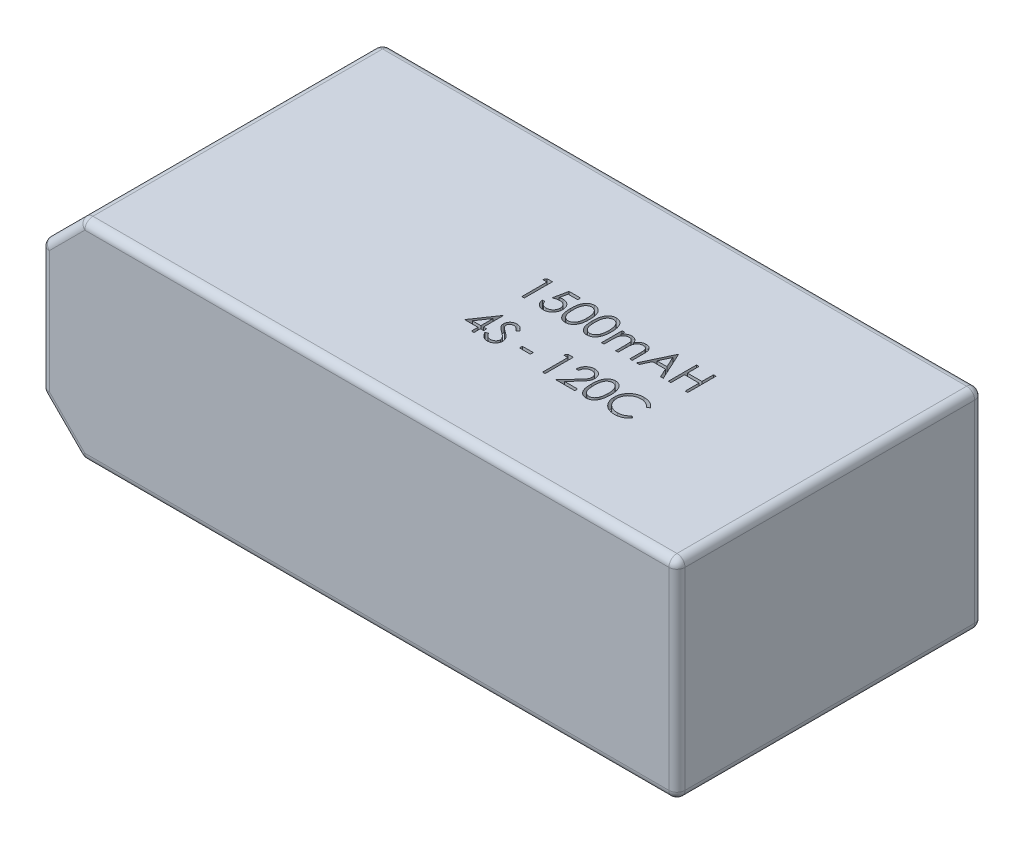
from build123d import *

# Parameters (mm, degrees)
SKETCH1_W           = 79
SKETCH1_H           = 38
BOSS_EXTRUDE1_DEPTH = 13
CHAMFER1_SIZE       = 5
FILLET1_R           = 1
SKETCH2_W           = 1.346153846
SKETCH2_H           = 0.358974359
CUT_EXTRUDE1_DEPTH  = 1


with BuildPart() as part:
    # Sketch1 → Boss-Extrude1 (new, symmetric)
    with BuildSketch(Plane(origin=(0, 0, 0), x_dir=(1, 0, 0), z_dir=(0, 1, 0))):
        Rectangle(SKETCH1_W, SKETCH1_H)
    extrude(amount=BOSS_EXTRUDE1_DEPTH, both=True)

    # Chamfer1
    chamfer1_edges = [part.edges().sort_by_distance(p)[0] for p in [
        (-39.5, 13, 0),
        (-39.5, -13, 0),
    ]]
    chamfer(chamfer1_edges, length=CHAMFER1_SIZE)

    # Fillet1
    fillet1_edges = [part.edges().sort_by_distance(p)[0] for p in [
        (39.5, -13, 0),
        (39.5, 13, 0),
        (-37, -10.5, -19),
        (-39.5, 0, -19),
        (-37, 10.5, -19),
        (2.5, -13, -19),
        (39.5, 0, -19),
        (2.5, 13, -19),
        (-37, -10.5, 19),
        (-39.5, 0, 19),
        (-37, 10.5, 19),
        (39.5, 0, 19),
        (2.5, 13, 19),
        (2.5, -13, 19),
        (-34.5, -13, 0),
        (-39.5, -8, 0),
        (-34.5, 13, 0),
        (-39.5, 8, 0),
    ]]
    fillet(fillet1_edges, radius=FILLET1_R)

    # Sketch2 → Cut-Extrude1 (cut)
    # profile 1 of 14: a face of its own
    with BuildSketch(Plane(origin=(0, 13, 0), x_dir=(1, 0, 0), z_dir=(0, 1, 0))):
        Polygon((0.878505609, 3.5), (1.525641026, 3.5), (1.525641026, 0), (1.211538462, 0), (1.211538462, 3.141025641), (0.673076923, 3.141025641), align=None)
    # profile 2 of 14: a face of its own
    with BuildSketch(Plane(origin=(0, 13, 0), x_dir=(1, 0, 0), z_dir=(0, 1, 0))):
        with BuildLine():
            Line((5.025641026, 3.5), (5.025641026, 3.141025641))
            Line((5.025641026, 3.141025641), (3.835136218, 3.141025641))
            Line((3.835136218, 3.141025641), (3.646534455, 2.220452724))
            add(Edge.make_bspline(
                [(3.646534455, 2.220452724), (3.68359033, 2.230682996), (3.755380225, 2.25050253), (3.861340086, 2.2725083), (3.96193229, 2.285773744), (4.02720766, 2.287585055), (4.058794071, 2.288461538)],
                knots=[0, 0, 0, 0, 1.100273476, 2.13160584, 3.095893838, 4, 4, 4, 4], degree=3))
            add(Edge.make_bspline(
                [(4.058794071, 2.288461538), (4.09787781, 2.287615603), (4.174726208, 2.285952282), (4.287165155, 2.269980432), (4.394498048, 2.244840518), (4.496500418, 2.209719996), (4.593360969, 2.164810263), (4.68418853, 2.108710322), (4.770346443, 2.043176991), (4.850289037, 1.967831979), (4.922813345, 1.884910363), (4.986579335, 1.795752492), (5.040741925, 1.701224829), (5.08430268, 1.600424221), (5.119087014, 1.494465067), (5.142239009, 1.382232485), (5.157655718, 1.264784365), (5.159378104, 1.184479795), (5.16025641, 1.143529647)],
                knots=[0, 0, 0, 0, 1.052922333, 2.070308379, 3.05430497, 4.020497103, 4.973039431, 5.925935799, 6.892292201, 7.88610001, 8.88166317, 9.857072816, 10.836096531, 11.812156883, 12.81219415, 13.836441305, 14.89672472, 16, 16, 16, 16], degree=3))
            add(Edge.make_bspline(
                [(5.16025641, 1.143529647), (5.159591335, 1.115007427), (5.158270172, 1.05834844), (5.151551585, 0.974204239), (5.138615869, 0.891841406), (5.121248145, 0.811249014), (5.098705727, 0.732579642), (5.071416673, 0.655608114), (5.038020645, 0.580813507), (5.00138927, 0.507488112), (4.960142792, 0.437289605), (4.914364285, 0.371640618), (4.865998793, 0.309556337), (4.813957408, 0.251702604), (4.757756413, 0.198459586), (4.698076446, 0.149511304), (4.635393727, 0.104029974), (4.568738485, 0.063861779), (4.499596002, 0.026898823), (4.426967784, -0.003424715), (4.352507084, -0.030535243), (4.275142208, -0.05214477), (4.195048396, -0.069077325), (4.11209362, -0.080577925), (4.02671295, -0.088954363), (3.968837938, -0.08947872), (3.939603365, -0.08974359)],
                knots=[0, 0, 0, 0, 1.056347294, 2.098418968, 3.122841568, 4.141288669, 5.149314143, 6.15115421, 7.162517403, 8.180376062, 9.185164535, 10.17417709, 11.141909838, 12.097768115, 13.052685741, 14.0056014, 14.954263652, 15.917497458, 16.885230207, 17.854509472, 18.828990115, 19.81800267, 20.826176721, 21.857883937, 22.917946725, 24, 24, 24, 24], degree=3))
            add(Edge.make_bspline(
                [(3.939603365, -0.08974359), (3.904729185, -0.089052752), (3.836118354, -0.08769361), (3.735597787, -0.073475124), (3.638883181, -0.053111208), (3.54675308, -0.022474938), (3.458381816, 0.015912357), (3.374959099, 0.064428528), (3.294353323, 0.119407632), (3.219841286, 0.184287985), (3.150685172, 0.255203667), (3.088778663, 0.332161308), (3.033645087, 0.41389075), (2.98616734, 0.500788904), (2.945669318, 0.592627435), (2.91385433, 0.689750436), (2.888175975, 0.79165044), (2.877312555, 0.86180395), (2.871794872, 0.897435897)],
                knots=[0, 0, 0, 0, 1.0467383, 2.05933395, 3.04377827, 4.011590433, 4.970194871, 5.932262533, 6.905835911, 7.896367577, 8.894135286, 9.877477877, 10.858688626, 11.851381753, 12.8477658, 13.868841284, 14.917554742, 16, 16, 16, 16], degree=3))
            Line((2.871794872, 0.897435897), (3.185897436, 0.897435897))
            add(Edge.make_bspline(
                [(3.185897436, 0.897435897), (3.193625993, 0.864059445), (3.20848071, 0.79990805), (3.241086458, 0.709776709), (3.280952334, 0.629457485), (3.328356682, 0.557887902), (3.384906713, 0.495478905), (3.449436142, 0.439861843), (3.521783865, 0.389686713), (3.602177095, 0.347863946), (3.686990174, 0.312195193), (3.775757384, 0.288443498), (3.86606173, 0.271742605), (3.927140101, 0.270070844), (3.957832532, 0.269230769)],
                knots=[0, 0, 0, 0, 1.136247022, 2.183929868, 3.172523383, 4.106158343, 5.02341133, 5.958108904, 6.928429099, 7.938127109, 8.96079061, 9.975095812, 10.982467395, 12, 12, 12, 12], degree=3))
            add(Edge.make_bspline(
                [(3.957832532, 0.269230769), (3.987790976, 0.270051547), (4.046779399, 0.271667666), (4.133590785, 0.284106678), (4.21740366, 0.303264249), (4.297391016, 0.331934104), (4.374952556, 0.366778822), (4.448126326, 0.411493898), (4.519029203, 0.462953917), (4.585457337, 0.521910547), (4.646296786, 0.586880241), (4.700052907, 0.656357635), (4.744829821, 0.730474481), (4.78256393, 0.807947634), (4.811217228, 0.889626191), (4.83165821, 0.975127366), (4.843661269, 1.064662347), (4.845312449, 1.125731656), (4.846153846, 1.156850962)],
                knots=[0, 0, 0, 0, 1.027316725, 2.022795036, 3.002884548, 3.971462791, 4.93288096, 5.914575861, 6.907176829, 7.935150275, 8.956128384, 9.956726525, 10.942570165, 11.921478529, 12.907843606, 13.90538589, 14.932640048, 16, 16, 16, 16], degree=3))
            add(Edge.make_bspline(
                [(4.846153846, 1.156850962), (4.845495367, 1.184926713), (4.844206487, 1.239881002), (4.833675917, 1.320280209), (4.815358944, 1.396353251), (4.789935064, 1.468467485), (4.757655557, 1.536690927), (4.718209244, 1.601093987), (4.670855846, 1.660827821), (4.616763958, 1.715920374), (4.557505917, 1.766765249), (4.492062174, 1.810109336), (4.421802247, 1.846573253), (4.347572648, 1.878041252), (4.267607749, 1.900641997), (4.183491117, 1.917609882), (4.094314409, 1.927425245), (4.033343721, 1.928787134), (4.002003205, 1.929487179)],
                knots=[0, 0, 0, 0, 1.045622112, 2.046656509, 3.013763289, 3.955457236, 4.890082067, 5.820317437, 6.762574623, 7.722996705, 8.69280354, 9.665887285, 10.63943826, 11.638615906, 12.663482002, 13.728887084, 14.832589034, 16, 16, 16, 16], degree=3))
            add(Edge.make_bspline(
                [(4.002003205, 1.929487179), (3.974874276, 1.928906588), (3.918859921, 1.927707815), (3.832937094, 1.918881318), (3.742645371, 1.904642024), (3.648330876, 1.885055776), (3.549710368, 1.859424699), (3.446991967, 1.828710199), (3.3399597, 1.7919882), (3.267841976, 1.764255986), (3.230769231, 1.75)],
                knots=[0, 0, 0, 0, 0.817624296, 1.688186739, 2.600797293, 3.572016777, 4.590301741, 5.671205678, 6.80286297, 8, 8, 8, 8], degree=3))
            Line((3.230769231, 1.75), (3.58974359, 3.5))
            Line((3.58974359, 3.5), (5.025641026, 3.5))
        make_face()
    # profile 3 of 14: a face of its own
    with BuildSketch(Plane(origin=(0, 13, 0), x_dir=(1, 0, 0), z_dir=(0, 1, 0))):
        with BuildLine():
            add(Edge.make_bspline(
                [(5.519230769, 1.748597756), (5.519558787, 1.804695144), (5.520195967, 1.913665128), (5.527284388, 2.07244977), (5.539059731, 2.221410059), (5.555197103, 2.360553125), (5.574835084, 2.48991489), (5.60105057, 2.609149647), (5.630863373, 2.718809254), (5.665415819, 2.819251302), (5.704403608, 2.911829005), (5.746837868, 2.998254207), (5.794402663, 3.078396139), (5.844379576, 3.153533929), (5.898791647, 3.222437624), (5.956090438, 3.286080287), (6.018512314, 3.342991037), (6.083935322, 3.394837339), (6.152951787, 3.440286811), (6.223594453, 3.48031955), (6.296349559, 3.514519417), (6.371415742, 3.541409853), (6.4481183, 3.5636207), (6.526725366, 3.578809647), (6.60736673, 3.588366556), (6.661798165, 3.589280224), (6.689403045, 3.58974359)],
                knots=[0, 0, 0, 0, 1.646270934, 3.197905019, 4.663502075, 6.030701355, 7.308322542, 8.50163776, 9.611534131, 10.641858119, 11.616356847, 12.558055219, 13.465016945, 14.349605745, 15.204443733, 16.039544428, 16.859896111, 17.680448484, 18.487036065, 19.28249412, 20.06191084, 20.843045899, 21.620316918, 22.403196591, 23.190181807, 24, 24, 24, 24], degree=3))
            add(Edge.make_bspline(
                [(6.689403045, 3.58974359), (6.717238523, 3.589255775), (6.772594532, 3.588285664), (6.854434907, 3.578961721), (6.934384589, 3.563490598), (7.012102728, 3.541569623), (7.088227714, 3.514373947), (7.162164122, 3.48028683), (7.234371204, 3.440607962), (7.303701491, 3.393984085), (7.370916107, 3.342001809), (7.43436407, 3.28323914), (7.494051155, 3.218289421), (7.550726461, 3.147847557), (7.602782058, 3.070562472), (7.65235549, 2.987778362), (7.696727526, 2.898047497), (7.739462201, 2.80286703), (7.776349188, 2.699603371), (7.809615433, 2.58883861), (7.836494402, 2.469264423), (7.858883674, 2.341508178), (7.87622857, 2.205100695), (7.888861212, 2.060334379), (7.895534297, 1.907113989), (7.896790999, 1.80235614), (7.897435897, 1.748597756)],
                knots=[0, 0, 0, 0, 0.810914788, 1.612654377, 2.396697861, 3.181598691, 3.963628158, 4.749916497, 5.551656086, 6.361998678, 7.18212741, 8.025565596, 8.878627764, 9.750805457, 10.657531673, 11.591944965, 12.560506719, 13.57287815, 14.630710178, 15.753379473, 16.941251878, 18.199788006, 19.531962791, 20.947069417, 22.433333509, 24, 24, 24, 24], degree=3))
            add(Edge.make_bspline(
                [(7.897435897, 1.748597756), (7.896784313, 1.695073848), (7.895514727, 1.590784697), (7.88893602, 1.438253721), (7.875977389, 1.294255678), (7.859767401, 1.158445216), (7.837316438, 1.031387597), (7.809711272, 0.912643148), (7.779060949, 0.801699077), (7.741226155, 0.699464265), (7.699815444, 0.604512542), (7.654760248, 0.515845394), (7.606490422, 0.432679101), (7.553901677, 0.355679354), (7.497848264, 0.284300697), (7.437130475, 0.219803074), (7.37345989, 0.160632402), (7.306047474, 0.107980775), (7.235635923, 0.06189597), (7.163676846, 0.02068212), (7.088893463, -0.012550575), (7.01298051, -0.041085616), (6.934852144, -0.062886068), (6.854605753, -0.077959923), (6.772649517, -0.088531772), (6.717247952, -0.089338252), (6.689403045, -0.08974359)],
                knots=[0, 0, 0, 0, 1.561518951, 3.042555995, 4.452378317, 5.7783523, 7.031515105, 8.214008947, 9.334062868, 10.386615937, 11.391082383, 12.354592575, 13.286541444, 14.194233754, 15.072674879, 15.931287219, 16.775624067, 17.606195743, 18.42308326, 19.229000347, 20.022332153, 20.807536673, 21.593273796, 22.3848459, 23.188221202, 24, 24, 24, 24], degree=3))
            add(Edge.make_bspline(
                [(6.689403045, -0.08974359), (6.661798931, -0.089277234), (6.607369006, -0.088357672), (6.526716581, -0.078843941), (6.448434137, -0.063548438), (6.372135383, -0.042131834), (6.297428868, -0.015916997), (6.225332581, 0.018236686), (6.155044898, 0.057570755), (6.086753342, 0.102366177), (6.021741181, 0.15368786), (5.959642575, 0.210452149), (5.902017556, 0.27407556), (5.848383461, 0.343553483), (5.797409372, 0.418246725), (5.750519999, 0.499175098), (5.707149145, 0.586017709), (5.667505654, 0.67933562), (5.632356991, 0.780490547), (5.601309283, 0.890639726), (5.576795125, 1.010755362), (5.55581217, 1.139872729), (5.538887787, 1.278546659), (5.527333462, 1.426852438), (5.520192147, 1.584697647), (5.519557076, 1.692967421), (5.519230769, 1.748597756)],
                knots=[0, 0, 0, 0, 0.810891512, 1.598919785, 2.382837074, 3.152667961, 3.926044502, 4.706494248, 5.493654104, 6.291793342, 7.103789334, 7.925228297, 8.761435821, 9.622817696, 10.50288917, 11.416980706, 12.369136599, 13.353924996, 14.394355917, 15.514179734, 16.714354668, 17.994756427, 19.357759367, 20.818452758, 22.365282078, 24, 24, 24, 24], degree=3))
        make_face()
        with BuildLine():
            add(Edge.make_bspline(
                [(5.833333333, 1.75), (5.83345278, 1.703251301), (5.833684604, 1.612521256), (5.839740804, 1.480677995), (5.847991036, 1.357707667), (5.858632333, 1.24345413), (5.874435282, 1.138304118), (5.89214207, 1.041534435), (5.913690159, 0.953657197), (5.939185177, 0.874069387), (5.968224274, 0.801420318), (5.999930138, 0.733819103), (6.033990861, 0.670467167), (6.072110011, 0.611933558), (6.113625075, 0.558027394), (6.157598334, 0.507794562), (6.205670918, 0.462997581), (6.27217466, 0.409270726), (6.359971135, 0.353751592), (6.47059159, 0.305405502), (6.584260041, 0.275023046), (6.661411291, 0.27115929), (6.699919872, 0.269230769)],
                knots=[0, 0, 0, 0, 1.459021318, 2.831673884, 4.118529203, 5.306027144, 6.411944654, 7.436330062, 8.375795394, 9.233974572, 10.042671642, 10.816086306, 11.563610507, 12.285937304, 12.993564865, 13.685989202, 14.367179055, 15.041617293, 16.353048772, 17.594441528, 18.799311195, 20, 20, 20, 20], degree=3))
            add(Edge.make_bspline(
                [(6.699919872, 0.269230769), (6.738677543, 0.27082855), (6.816112867, 0.274020813), (6.929246662, 0.30481955), (7.039076932, 0.35128909), (7.125148872, 0.406236595), (7.190631416, 0.458564925), (7.237548406, 0.503179573), (7.280610454, 0.55313544), (7.321452529, 0.607034736), (7.358911605, 0.66590722), (7.392974742, 0.729469796), (7.42405809, 0.797898973), (7.441767136, 0.845668713), (7.450821314, 0.870092147)],
                knots=[0, 0, 0, 0, 1.353760809, 2.704726607, 4.075137775, 5.516104923, 6.260822281, 7.007110065, 7.778089737, 8.566572457, 9.372053459, 10.217411131, 11.088608312, 12, 12, 12, 12], degree=3))
            add(Edge.make_bspline(
                [(7.450821314, 0.870092147), (7.461373082, 0.901321887), (7.482797696, 0.964731651), (7.51040947, 1.063095303), (7.532154869, 1.166298067), (7.551718235, 1.273723184), (7.565071291, 1.386162885), (7.575819104, 1.503269269), (7.582149791, 1.625130631), (7.582934542, 1.707925622), (7.583333333, 1.75)],
                knots=[0, 0, 0, 0, 0.884706709, 1.796334032, 2.740027952, 3.714592787, 4.726048262, 5.777819803, 6.87074269, 8, 8, 8, 8], degree=3))
            add(Edge.make_bspline(
                [(7.583333333, 1.75), (7.582783144, 1.792067573), (7.581706856, 1.874360737), (7.577592869, 1.994878918), (7.566969294, 2.109346679), (7.555170175, 2.218257152), (7.537772954, 2.321007454), (7.519015147, 2.418457759), (7.493813935, 2.509400784), (7.46689416, 2.595260366), (7.436083765, 2.675061021), (7.40216803, 2.749174807), (7.365946271, 2.817959532), (7.326604031, 2.881226473), (7.284608348, 2.939259016), (7.238850799, 2.990893611), (7.191146426, 3.037730579), (7.12432924, 3.091193148), (7.03685495, 3.145704843), (6.928009303, 3.195870603), (6.814738659, 3.224678896), (6.738165205, 3.228740583), (6.699919872, 3.230769231)],
                knots=[0, 0, 0, 0, 1.31362396, 2.569729283, 3.763502607, 4.902122613, 5.988968491, 7.01645872, 7.998833611, 8.933434873, 9.825090667, 10.667526885, 11.477055099, 12.250526234, 12.991942729, 13.710640831, 14.402115721, 15.076753259, 16.378508321, 17.609869233, 18.806226677, 20, 20, 20, 20], degree=3))
            add(Edge.make_bspline(
                [(6.699919872, 3.230769231), (6.66120928, 3.228737784), (6.583717574, 3.22467119), (6.469269619, 3.195977936), (6.359565268, 3.14596497), (6.272322293, 3.091012598), (6.205458507, 3.038674287), (6.158375813, 2.993287833), (6.114229641, 2.943641578), (6.073561941, 2.889239663), (6.035472658, 2.830774296), (6.000491645, 2.767785531), (5.968974315, 2.699954167), (5.939889779, 2.627337732), (5.914316991, 2.547756787), (5.893223028, 2.459987794), (5.873735975, 2.363525902), (5.859940706, 2.257806394), (5.84767695, 2.14352424), (5.839795602, 2.020246922), (5.833664345, 1.888182542), (5.83344588, 1.796983383), (5.833333333, 1.75)],
                knots=[0, 0, 0, 0, 1.207732386, 2.417664972, 3.655092373, 4.956220595, 5.625982001, 6.301752483, 6.994047911, 7.697131622, 8.419323945, 9.170223765, 9.943494443, 10.752040957, 11.610060368, 12.549350801, 13.567764191, 14.679664412, 15.874934091, 17.154273443, 18.533957287, 20, 20, 20, 20], degree=3))
        make_face(mode=Mode.SUBTRACT)
    # profile 4 of 14: a face of its own
    with BuildSketch(Plane(origin=(0, 13, 0), x_dir=(1, 0, 0), z_dir=(0, 1, 0))):
        with BuildLine():
            add(Edge.make_bspline(
                [(8.211538462, 1.748597756), (8.21186648, 1.804695144), (8.21250366, 1.913665128), (8.219592081, 2.07244977), (8.231367423, 2.221410059), (8.247504796, 2.360553125), (8.267142776, 2.48991489), (8.293358263, 2.609149647), (8.323171065, 2.718809254), (8.357723511, 2.819251302), (8.3967113, 2.911829005), (8.439145561, 2.998254207), (8.486710355, 3.078396139), (8.536687268, 3.153533929), (8.59109934, 3.222437624), (8.64839813, 3.286080287), (8.710820007, 3.342991037), (8.776243015, 3.394837339), (8.845259479, 3.440286811), (8.915902145, 3.48031955), (8.988657251, 3.514519417), (9.063723434, 3.541409853), (9.140425992, 3.5636207), (9.219033059, 3.578809647), (9.299674423, 3.588366556), (9.354105857, 3.589280224), (9.381710737, 3.58974359)],
                knots=[0, 0, 0, 0, 1.646270934, 3.197905019, 4.663502075, 6.030701355, 7.308322542, 8.50163776, 9.611534131, 10.641858119, 11.616356847, 12.558055219, 13.465016945, 14.349605745, 15.204443733, 16.039544428, 16.859896111, 17.680448484, 18.487036065, 19.28249412, 20.06191084, 20.843045899, 21.620316918, 22.403196591, 23.190181807, 24, 24, 24, 24], degree=3))
            add(Edge.make_bspline(
                [(9.381710737, 3.58974359), (9.409546216, 3.589255775), (9.464902225, 3.588285664), (9.5467426, 3.578961721), (9.626692282, 3.563490598), (9.70441042, 3.541569623), (9.780535407, 3.514373947), (9.854471814, 3.48028683), (9.926678896, 3.440607962), (9.996009183, 3.393984085), (10.063223799, 3.342001809), (10.126671762, 3.28323914), (10.186358848, 3.218289421), (10.243034153, 3.147847557), (10.29508975, 3.070562472), (10.344663183, 2.987778362), (10.389035218, 2.898047497), (10.431769894, 2.80286703), (10.46865688, 2.699603371), (10.501923126, 2.58883861), (10.528802094, 2.469264423), (10.551191367, 2.341508178), (10.568536262, 2.205100695), (10.581168905, 2.060334379), (10.58784199, 1.907113989), (10.589098691, 1.80235614), (10.58974359, 1.748597756)],
                knots=[0, 0, 0, 0, 0.810914788, 1.612654377, 2.396697861, 3.181598691, 3.963628158, 4.749916497, 5.551656086, 6.361998678, 7.18212741, 8.025565596, 8.878627764, 9.750805457, 10.657531673, 11.591944965, 12.560506719, 13.57287815, 14.630710178, 15.753379473, 16.941251878, 18.199788006, 19.531962791, 20.947069417, 22.433333509, 24, 24, 24, 24], degree=3))
            add(Edge.make_bspline(
                [(10.58974359, 1.748597756), (10.589092005, 1.695073848), (10.587822419, 1.590784697), (10.581243713, 1.438253721), (10.568285081, 1.294255678), (10.552075093, 1.158445216), (10.52962413, 1.031387597), (10.502018964, 0.912643148), (10.471368641, 0.801699077), (10.433533847, 0.699464265), (10.392123137, 0.604512542), (10.34706794, 0.515845394), (10.298798114, 0.432679101), (10.246209369, 0.355679354), (10.190155956, 0.284300697), (10.129438167, 0.219803074), (10.065767582, 0.160632402), (9.998355166, 0.107980775), (9.927943615, 0.06189597), (9.855984538, 0.02068212), (9.781201155, -0.012550575), (9.705288202, -0.041085616), (9.627159836, -0.062886068), (9.546913445, -0.077959923), (9.464957209, -0.088531772), (9.409555644, -0.089338252), (9.381710737, -0.08974359)],
                knots=[0, 0, 0, 0, 1.561518951, 3.042555995, 4.452378317, 5.7783523, 7.031515105, 8.214008947, 9.334062868, 10.386615937, 11.391082383, 12.354592575, 13.286541444, 14.194233754, 15.072674879, 15.931287219, 16.775624067, 17.606195743, 18.42308326, 19.229000347, 20.022332153, 20.807536673, 21.593273796, 22.3848459, 23.188221202, 24, 24, 24, 24], degree=3))
            add(Edge.make_bspline(
                [(9.381710737, -0.08974359), (9.354106623, -0.089277234), (9.299676698, -0.088357672), (9.219024273, -0.078843941), (9.14074183, -0.063548438), (9.064443076, -0.042131834), (8.98973656, -0.015916997), (8.917640274, 0.018236686), (8.84735259, 0.057570755), (8.779061034, 0.102366177), (8.714048873, 0.15368786), (8.651950268, 0.210452149), (8.594325249, 0.27407556), (8.540691153, 0.343553483), (8.489717065, 0.418246725), (8.442827691, 0.499175098), (8.399456837, 0.586017709), (8.359813347, 0.67933562), (8.324664683, 0.780490547), (8.293616975, 0.890639726), (8.269102818, 1.010755362), (8.248119862, 1.139872729), (8.231195479, 1.278546659), (8.219641154, 1.426852438), (8.212499839, 1.584697647), (8.211864768, 1.692967421), (8.211538462, 1.748597756)],
                knots=[0, 0, 0, 0, 0.810891512, 1.598919785, 2.382837074, 3.152667961, 3.926044502, 4.706494248, 5.493654104, 6.291793342, 7.103789334, 7.925228297, 8.761435821, 9.622817696, 10.50288917, 11.416980706, 12.369136599, 13.353924996, 14.394355917, 15.514179734, 16.714354668, 17.994756427, 19.357759367, 20.818452758, 22.365282078, 24, 24, 24, 24], degree=3))
        make_face()
        with BuildLine():
            add(Edge.make_bspline(
                [(8.525641026, 1.75), (8.525760473, 1.703251301), (8.525992296, 1.612521256), (8.532048497, 1.480677995), (8.540298729, 1.357707667), (8.550940026, 1.24345413), (8.566742974, 1.138304118), (8.584449762, 1.041534435), (8.605997852, 0.953657197), (8.63149287, 0.874069387), (8.660531966, 0.801420318), (8.69223783, 0.733819103), (8.726298553, 0.670467167), (8.764417704, 0.611933558), (8.805932767, 0.558027394), (8.849906026, 0.507794562), (8.89797861, 0.462997581), (8.964482353, 0.409270726), (9.052278827, 0.353751592), (9.162899282, 0.305405502), (9.276567733, 0.275023046), (9.353718984, 0.27115929), (9.392227564, 0.269230769)],
                knots=[0, 0, 0, 0, 1.459021318, 2.831673884, 4.118529203, 5.306027144, 6.411944654, 7.436330062, 8.375795394, 9.233974572, 10.042671642, 10.816086306, 11.563610507, 12.285937304, 12.993564865, 13.685989202, 14.367179055, 15.041617293, 16.353048772, 17.594441528, 18.799311195, 20, 20, 20, 20], degree=3))
            add(Edge.make_bspline(
                [(9.392227564, 0.269230769), (9.430985236, 0.27082855), (9.508420559, 0.274020813), (9.621554354, 0.30481955), (9.731384624, 0.35128909), (9.817456564, 0.406236595), (9.882939108, 0.458564925), (9.929856098, 0.503179573), (9.972918146, 0.55313544), (10.013760221, 0.607034736), (10.051219297, 0.66590722), (10.085282435, 0.729469796), (10.116365782, 0.797898973), (10.134074828, 0.845668713), (10.143129006, 0.870092147)],
                knots=[0, 0, 0, 0, 1.353760809, 2.704726607, 4.075137775, 5.516104923, 6.260822281, 7.007110065, 7.778089737, 8.566572457, 9.372053459, 10.217411131, 11.088608312, 12, 12, 12, 12], degree=3))
            add(Edge.make_bspline(
                [(10.143129006, 0.870092147), (10.153680774, 0.901321887), (10.175105388, 0.964731651), (10.202717162, 1.063095303), (10.224462562, 1.166298067), (10.244025927, 1.273723184), (10.257378983, 1.386162885), (10.268126796, 1.503269269), (10.274457483, 1.625130631), (10.275242234, 1.707925622), (10.275641026, 1.75)],
                knots=[0, 0, 0, 0, 0.884706709, 1.796334032, 2.740027952, 3.714592787, 4.726048262, 5.777819803, 6.87074269, 8, 8, 8, 8], degree=3))
            add(Edge.make_bspline(
                [(10.275641026, 1.75), (10.275090836, 1.792067573), (10.274014549, 1.874360737), (10.269900561, 1.994878918), (10.259276986, 2.109346679), (10.247477868, 2.218257152), (10.230080647, 2.321007454), (10.21132284, 2.418457759), (10.186121627, 2.509400784), (10.159201852, 2.595260366), (10.128391457, 2.675061021), (10.094475723, 2.749174807), (10.058253964, 2.817959532), (10.018911723, 2.881226473), (9.97691604, 2.939259016), (9.931158491, 2.990893611), (9.883454118, 3.037730579), (9.816636932, 3.091193148), (9.729162643, 3.145704843), (9.620316995, 3.195870603), (9.507046351, 3.224678896), (9.430472897, 3.228740583), (9.392227564, 3.230769231)],
                knots=[0, 0, 0, 0, 1.31362396, 2.569729283, 3.763502607, 4.902122613, 5.988968491, 7.01645872, 7.998833611, 8.933434873, 9.825090667, 10.667526885, 11.477055099, 12.250526234, 12.991942729, 13.710640831, 14.402115721, 15.076753259, 16.378508321, 17.609869233, 18.806226677, 20, 20, 20, 20], degree=3))
            add(Edge.make_bspline(
                [(9.392227564, 3.230769231), (9.353516972, 3.228737784), (9.276025266, 3.22467119), (9.161577312, 3.195977936), (9.05187296, 3.14596497), (8.964629985, 3.091012598), (8.897766199, 3.038674287), (8.850683505, 2.993287833), (8.806537333, 2.943641578), (8.765869633, 2.889239663), (8.72778035, 2.830774296), (8.692799337, 2.767785531), (8.661282008, 2.699954167), (8.632197471, 2.627337732), (8.606624683, 2.547756787), (8.58553072, 2.459987794), (8.566043667, 2.363525902), (8.552248398, 2.257806394), (8.539984642, 2.14352424), (8.532103295, 2.020246922), (8.525972037, 1.888182542), (8.525753573, 1.796983383), (8.525641026, 1.75)],
                knots=[0, 0, 0, 0, 1.207732386, 2.417664972, 3.655092373, 4.956220595, 5.625982001, 6.301752483, 6.994047911, 7.697131622, 8.419323945, 9.170223765, 9.943494443, 10.752040957, 11.610060368, 12.549350801, 13.567764191, 14.679664412, 15.874934091, 17.154273443, 18.533957287, 20, 20, 20, 20], degree=3))
        make_face(mode=Mode.SUBTRACT)
    # profile 5 of 14: a face of its own
    with BuildSketch(Plane(origin=(0, 13, 0), x_dir=(1, 0, 0), z_dir=(0, 1, 0))):
        with BuildLine():
            Line((11.128205128, 2.557692308), (11.442307692, 2.557692308))
            Line((11.442307692, 2.557692308), (11.442307692, 2.11318109))
            add(Edge.make_bspline(
                [(11.442307692, 2.11318109), (11.470591642, 2.152068691), (11.524786402, 2.226581065), (11.613652054, 2.324771349), (11.702428167, 2.408099503), (11.766361549, 2.451842375), (11.797075321, 2.472856571)],
                knots=[0, 0, 0, 0, 1.134379233, 2.173579362, 3.122582517, 4, 4, 4, 4], degree=3))
            add(Edge.make_bspline(
                [(11.797075321, 2.472856571), (11.838939983, 2.492861936), (11.921937882, 2.532523149), (12.053357107, 2.572756708), (12.187831777, 2.597481809), (12.278639991, 2.600863183), (12.32431891, 2.602564103)],
                knots=[0, 0, 0, 0, 1.014936303, 2.012140481, 3.000054389, 4, 4, 4, 4], degree=3))
            add(Edge.make_bspline(
                [(12.32431891, 2.602564103), (12.355211907, 2.601518812), (12.416347486, 2.599450238), (12.506931576, 2.585990202), (12.594790188, 2.562724029), (12.679404217, 2.530316705), (12.759124896, 2.491070018), (12.832214094, 2.445020311), (12.897838302, 2.393323235), (12.955964354, 2.333644302), (13.008233379, 2.264307704), (13.056312226, 2.183443455), (13.100737438, 2.089235794), (13.125358747, 2.020869253), (13.138321314, 1.984875801)],
                knots=[0, 0, 0, 0, 1.009824226, 1.998387844, 2.986035974, 3.974953746, 4.955485308, 5.885931332, 6.793869504, 7.679848016, 8.601185859, 9.625726857, 10.749998409, 12, 12, 12, 12], degree=3))
            add(Edge.make_bspline(
                [(13.138321314, 1.984875801), (13.152032565, 2.009600221), (13.179014383, 2.058254406), (13.22432002, 2.127112668), (13.271787816, 2.19151946), (13.321822309, 2.251525884), (13.374246896, 2.306835614), (13.429308296, 2.357631516), (13.486693078, 2.40413173), (13.566485318, 2.458454889), (13.670297925, 2.516156071), (13.80118604, 2.566184515), (13.937336211, 2.597100643), (14.02975391, 2.600730916), (14.076422276, 2.602564103)],
                knots=[0, 0, 0, 0, 0.86119277, 1.694706429, 2.50939023, 3.298075842, 4.073795165, 4.829715201, 5.57930267, 6.321991688, 7.768977793, 9.186738141, 10.579381044, 12, 12, 12, 12], degree=3))
            add(Edge.make_bspline(
                [(14.076422276, 2.602564103), (14.119303738, 2.600946882), (14.203226925, 2.597781823), (14.32540419, 2.57292835), (14.439345996, 2.530250703), (14.544823072, 2.472017066), (14.639982885, 2.398837883), (14.722699194, 2.311769046), (14.792469558, 2.211426423), (14.838048198, 2.117034434), (14.868963462, 2.033699101), (14.888024696, 1.96269281), (14.904864391, 1.884541257), (14.918845636, 1.799150995), (14.929064189, 1.706220387), (14.936634904, 1.605901511), (14.941758978, 1.498116399), (14.94212105, 1.423750899), (14.942307692, 1.385416667)],
                knots=[0, 0, 0, 0, 1.209669288, 2.367440248, 3.500751976, 4.631527125, 5.755587489, 6.87532382, 8.007944318, 9.190864318, 9.82315674, 10.514484317, 11.263564316, 12.079023757, 12.955305781, 13.901327259, 14.918167583, 16, 16, 16, 16], degree=3))
            Line((14.942307692, 1.385416667), (14.942307692, 0))
            Line((14.942307692, 0), (14.628205128, 0))
            Line((14.628205128, 0), (14.628205128, 1.38681891))
            add(Edge.make_bspline(
                [(14.628205128, 1.38681891), (14.628127245, 1.419539484), (14.627977566, 1.482423451), (14.625283934, 1.572675902), (14.62020862, 1.654944259), (14.614273982, 1.729116348), (14.606030172, 1.795365136), (14.59538424, 1.853557555), (14.584106561, 1.904151366), (14.565370569, 1.960237414), (14.535422678, 2.022107624), (14.489805198, 2.0888312), (14.432335092, 2.146912), (14.365974935, 2.197330317), (14.29042649, 2.238323958), (14.207161767, 2.267599968), (14.116697716, 2.285722846), (14.054074927, 2.287528862), (14.021734776, 2.288461538)],
                knots=[0, 0, 0, 0, 1.253487763, 2.409012846, 3.458416907, 4.410876679, 5.259312806, 6.014470957, 6.676830364, 7.243083969, 8.276244668, 9.299465089, 10.325150304, 11.392391894, 12.482080715, 13.603491619, 14.762376348, 16, 16, 16, 16], degree=3))
            add(Edge.make_bspline(
                [(14.021734776, 2.288461538), (13.982064821, 2.287045381), (13.90366191, 2.284246516), (13.789216424, 2.255672643), (13.679245407, 2.212592392), (13.577030274, 2.150159935), (13.483002484, 2.075351571), (13.402102906, 1.986401975), (13.33527072, 1.885772048), (13.290016744, 1.792625346), (13.261427443, 1.708955902), (13.242550527, 1.63585853), (13.227867136, 1.552776962), (13.214096607, 1.460269472), (13.205108879, 1.357699291), (13.196940506, 1.24554089), (13.193119644, 1.123456931), (13.192585185, 1.038830242), (13.192307692, 0.994891827)],
                knots=[0, 0, 0, 0, 1.090531906, 2.155305635, 3.229839962, 4.33261226, 5.44038871, 6.529323825, 7.629011124, 8.757537029, 9.370236727, 10.061839251, 10.834451254, 11.692844982, 12.636905849, 13.66920014, 14.789842145, 16, 16, 16, 16], degree=3))
            Line((13.192307692, 0.994891827), (13.192307692, 0))
            Line((13.192307692, 0), (12.878205128, 0))
            Line((12.878205128, 0), (12.878205128, 1.300580929))
            add(Edge.make_bspline(
                [(12.878205128, 1.300580929), (12.878125697, 1.337274248), (12.87797288, 1.407868505), (12.875296563, 1.509102181), (12.870209941, 1.601183261), (12.864329393, 1.684004725), (12.855869214, 1.757416053), (12.846259452, 1.821810811), (12.834910841, 1.877027563), (12.816120957, 1.937590947), (12.787406489, 2.00431187), (12.741218227, 2.075452892), (12.683610646, 2.137720989), (12.61603977, 2.190879738), (12.540034088, 2.234821219), (12.456050687, 2.266480971), (12.364845775, 2.28490526), (12.301968069, 2.287253757), (12.26963141, 2.288461538)],
                knots=[0, 0, 0, 0, 1.320475261, 2.540461679, 3.643808994, 4.639130445, 5.527981419, 6.302341397, 6.981980563, 7.553956391, 8.582137848, 9.585246428, 10.591171744, 11.620968678, 12.668337649, 13.738356861, 14.836885341, 16, 16, 16, 16], degree=3))
            add(Edge.make_bspline(
                [(12.26963141, 2.288461538), (12.231615199, 2.286931078), (12.155850239, 2.283880926), (12.04454827, 2.256426652), (11.937062586, 2.213422577), (11.835107887, 2.153762758), (11.741433739, 2.07986368), (11.659425472, 1.992948784), (11.590482946, 1.89409975), (11.544751131, 1.801935234), (11.515252657, 1.720361959), (11.495657323, 1.651011011), (11.478817697, 1.574010763), (11.466303675, 1.489123652), (11.454223259, 1.396902558), (11.44839295, 1.296888068), (11.442721388, 1.18916598), (11.442448973, 1.114793435), (11.442307692, 1.076221955)],
                knots=[0, 0, 0, 0, 1.098833095, 2.189935336, 3.297829714, 4.440610912, 5.596351641, 6.740013378, 7.886572111, 9.072425424, 9.705826452, 10.395263256, 11.156850408, 11.985370555, 12.878090359, 13.847760091, 14.883794034, 16, 16, 16, 16], degree=3))
            Line((11.442307692, 1.076221955), (11.442307692, 0))
            Line((11.442307692, 0), (11.128205128, 0))
            Line((11.128205128, 0), (11.128205128, 2.557692308))
        make_face()
    # profile 6 of 14: a face of its own
    with BuildSketch(Plane(origin=(0, 13, 0), x_dir=(1, 0, 0), z_dir=(0, 1, 0))):
        Polygon((17.185897436, 3.5), (18.801282051, 0), (18.459835737, 0), (17.942407853, 1.121794872), (16.355769231, 1.121794872), (15.823617788, 0), (15.480769231, 0), (17.141025641, 3.5), align=None)
        Polygon((17.159955929, 2.817808494), (16.526141827, 1.480769231), (17.776943109, 1.480769231), align=None, mode=Mode.SUBTRACT)
    # profile 7 of 14: a face of its own
    with BuildSketch(Plane(origin=(0, 13, 0), x_dir=(1, 0, 0), z_dir=(0, 1, 0))):
        Polygon((19.429487179, 3.5), (19.743589744, 3.5), (19.743589744, 2.064102564), (21.538461538, 2.064102564), (21.538461538, 3.5), (21.852564103, 3.5), (21.852564103, 0), (21.538461538, 0), (21.538461538, 1.705128205), (19.743589744, 1.705128205), (19.743589744, 0), (19.429487179, 0), align=None)
    # profile 8 of 14: a face of its own
    with BuildSketch(Plane(origin=(0, 13, 0), x_dir=(1, 0, 0), z_dir=(0, 1, 0))):
        Polygon((2.045172276, -3.243589744), (2.108974359, -3.243589744), (2.108974359, -5.666666667), (2.512820513, -5.666666667), (2.512820513, -6.025641026), (2.108974359, -6.025641026), (2.108974359, -6.833333333), (1.794871795, -6.833333333), (1.794871795, -6.025641026), (0.134615385, -6.025641026), align=None)
        Polygon((1.794871795, -5.666666667), (1.794871795, -4.146634615), (0.751602564, -5.666666667), align=None, mode=Mode.SUBTRACT)
    # profile 9 of 14: a face of its own
    with BuildSketch(Plane(origin=(0, 13, 0), x_dir=(1, 0, 0), z_dir=(0, 1, 0))):
        with BuildLine():
            Line((2.782051282, -6.158153045), (3.077924679, -5.980769231))
            add(Edge.make_bspline(
                [(3.077924679, -5.980769231), (3.105442917, -6.026833616), (3.158166797, -6.1150912), (3.246118157, -6.23434924), (3.337251068, -6.335711397), (3.432240401, -6.418588004), (3.530506349, -6.483836891), (3.632690403, -6.530039123), (3.738448214, -6.558855098), (3.810422035, -6.562355185), (3.846354167, -6.564102564)],
                knots=[0, 0, 0, 0, 1.272034388, 2.437168799, 3.508375237, 4.49857839, 5.41946034, 6.295179144, 7.148887113, 8, 8, 8, 8], degree=3))
            add(Edge.make_bspline(
                [(3.846354167, -6.564102564), (3.877041027, -6.563247892), (3.9378778, -6.561553501), (4.027440043, -6.545272699), (4.114421845, -6.52026057), (4.197030483, -6.484439639), (4.274126098, -6.441101153), (4.341732793, -6.388754976), (4.400178906, -6.33014877), (4.447988021, -6.264766115), (4.484668056, -6.194448967), (4.512860124, -6.122273015), (4.528505198, -6.047104447), (4.530861952, -5.996493984), (4.532051282, -5.970953526)],
                knots=[0, 0, 0, 0, 1.095163259, 2.171163733, 3.241058638, 4.321873601, 5.38011039, 6.391990106, 7.366004449, 8.327778327, 9.272591725, 10.192022065, 11.087607919, 12, 12, 12, 12], degree=3))
            add(Edge.make_bspline(
                [(4.532051282, -5.970953526), (4.530576971, -5.941812676), (4.527579913, -5.882573587), (4.502248433, -5.795173934), (4.462399186, -5.708681364), (4.425636543, -5.655180098), (4.406550481, -5.627403846)],
                knots=[0, 0, 0, 0, 0.938893495, 1.908633276, 2.914225137, 4, 4, 4, 4], degree=3))
            add(Edge.make_bspline(
                [(4.406550481, -5.627403846), (4.390879867, -5.607357023), (4.357981372, -5.565271224), (4.30142386, -5.502625989), (4.235057745, -5.43800757), (4.16115419, -5.368948513), (4.077021102, -5.298660716), (3.985293587, -5.223792438), (3.883629728, -5.147190861), (3.812330232, -5.095818295), (3.775540865, -5.069310897)],
                knots=[0, 0, 0, 0, 0.722233717, 1.516239348, 2.393582979, 3.351407094, 4.387010283, 5.505090956, 6.712668013, 8, 8, 8, 8], degree=3))
            add(Edge.make_bspline(
                [(3.775540865, -5.069310897), (3.738716869, -5.04308231), (3.668312193, -4.992935248), (3.56985361, -4.918510964), (3.481809147, -4.850467094), (3.404570131, -4.788163082), (3.338170534, -4.731590477), (3.282087123, -4.681292538), (3.237748566, -4.635908977), (3.213092985, -4.606467635), (3.202023237, -4.593249199)],
                knots=[0, 0, 0, 0, 1.452282411, 2.77665338, 3.964542531, 5.026858415, 5.96415736, 6.766646006, 7.446254459, 8, 8, 8, 8], degree=3))
            add(Edge.make_bspline(
                [(3.202023237, -4.593249199), (3.186550692, -4.572648162), (3.156121855, -4.532133458), (3.11595585, -4.4688086), (3.081816687, -4.403985335), (3.055054355, -4.33748947), (3.032518136, -4.270254541), (3.017360205, -4.201403296), (3.007868808, -4.131244677), (3.006896822, -4.084031177), (3.006410256, -4.060396635)],
                knots=[0, 0, 0, 0, 1.068054152, 2.10047183, 3.106115577, 4.101338837, 5.06977816, 6.043150881, 7.020423561, 8, 8, 8, 8], degree=3))
            add(Edge.make_bspline(
                [(3.006410256, -4.060396635), (3.007715465, -4.02336686), (3.010297985, -3.950098796), (3.032138503, -3.843067966), (3.066611396, -3.740881549), (3.114906284, -3.644551215), (3.177163637, -3.556585234), (3.249209612, -3.475971747), (3.335021098, -3.408203165), (3.429173721, -3.348991106), (3.532230093, -3.302645181), (3.640220997, -3.267684201), (3.753318069, -3.247874943), (3.829921203, -3.245032178), (3.868790064, -3.243589744)],
                knots=[0, 0, 0, 0, 1.005424448, 1.989358655, 2.955360095, 3.929531133, 4.905563448, 5.876582895, 6.856512386, 7.866279853, 8.892233794, 9.918561126, 10.94386622, 12, 12, 12, 12], degree=3))
            add(Edge.make_bspline(
                [(3.868790064, -3.243589744), (3.910034164, -3.245012295), (3.992055516, -3.247841296), (4.112704732, -3.272438828), (4.228865448, -3.313139499), (4.322308713, -3.359328157), (4.395441474, -3.405459573), (4.451214207, -3.447479397), (4.507731658, -3.495854506), (4.565449713, -3.550713752), (4.623390372, -3.612560503), (4.682413824, -3.680971192), (4.742658093, -3.755527748), (4.781413953, -3.808752249), (4.801282051, -3.83603766)],
                knots=[0, 0, 0, 0, 1.286793592, 2.559021753, 3.825965368, 5.121522368, 5.803751409, 6.523245864, 7.299691795, 8.125521123, 9.008227632, 9.944561021, 10.946284179, 12, 12, 12, 12], degree=3))
            Line((4.801282051, -3.83603766), (4.517327724, -4.051282051))
            add(Edge.make_bspline(
                [(4.517327724, -4.051282051), (4.500181792, -4.029193361), (4.467162735, -3.986655708), (4.417033248, -3.927084392), (4.3697846, -3.872667912), (4.3232342, -3.825402784), (4.279840569, -3.782700651), (4.237723527, -3.746140894), (4.197489175, -3.715365299), (4.146772265, -3.682521739), (4.083054546, -3.649965235), (4.00307001, -3.622416157), (3.919483735, -3.605861095), (3.862554104, -3.603672208), (3.833733974, -3.602564103)],
                knots=[0, 0, 0, 0, 1.181633172, 2.275549214, 3.290209073, 4.226197932, 5.078386478, 5.862611352, 6.581680152, 7.217281963, 8.414376989, 9.595101626, 10.782541182, 12, 12, 12, 12], degree=3))
            add(Edge.make_bspline(
                [(3.833733974, -3.602564103), (3.797577452, -3.603775803), (3.727853005, -3.606112452), (3.628862768, -3.631632437), (3.539768843, -3.671814297), (3.463216278, -3.728129275), (3.399479301, -3.794850268), (3.353373843, -3.871629123), (3.325623678, -3.956411526), (3.322237398, -4.015553182), (3.320512821, -4.045673077)],
                knots=[0, 0, 0, 0, 1.14458467, 2.207223713, 3.21896685, 4.227309161, 5.202851033, 6.127160689, 7.046193047, 8, 8, 8, 8], degree=3))
            add(Edge.make_bspline(
                [(3.320512821, -4.045673077), (3.320905947, -4.064424555), (3.321692843, -4.101958175), (3.332667641, -4.157409597), (3.34676697, -4.212720936), (3.369109602, -4.267643519), (3.399954905, -4.323137878), (3.440460081, -4.380159616), (3.491473393, -4.439211324), (3.530550406, -4.477618698), (3.551181891, -4.497896635)],
                knots=[0, 0, 0, 0, 0.858281714, 1.717966888, 2.583508476, 3.4729293, 4.427298488, 5.488583878, 6.674047936, 8, 8, 8, 8], degree=3))
            add(Edge.make_bspline(
                [(3.551181891, -4.497896635), (3.558843263, -4.50473366), (3.577044931, -4.520976869), (3.610320856, -4.547569149), (3.654263655, -4.580371922), (3.707725856, -4.620959238), (3.771693217, -4.6680407), (3.846172774, -4.721014312), (3.930334306, -4.781599771), (3.990056222, -4.823957312), (4.021634615, -4.846354167)],
                knots=[0, 0, 0, 0, 0.420754252, 0.999615792, 1.744751191, 2.668019286, 3.750313428, 4.999500688, 6.413464383, 8, 8, 8, 8], degree=3))
            add(Edge.make_bspline(
                [(4.021634615, -4.846354167), (4.059620529, -4.873995526), (4.133174985, -4.927519188), (4.237832565, -5.007934868), (4.332726373, -5.086582637), (4.418189577, -5.162960244), (4.495066485, -5.236488337), (4.562504206, -5.308051517), (4.621189886, -5.37713709), (4.684369105, -5.465709665), (4.748926924, -5.57449075), (4.804368432, -5.707768988), (4.839326779, -5.841565309), (4.843898294, -5.931492145), (4.846153846, -5.975861378)],
                knots=[0, 0, 0, 0, 1.163667725, 2.253281268, 3.268753668, 4.215851969, 5.092017293, 5.902905408, 6.650798638, 7.335211899, 8.59617414, 9.77448103, 10.901945474, 12, 12, 12, 12], degree=3))
            add(Edge.make_bspline(
                [(4.846153846, -5.975861378), (4.845496708, -6.007239743), (4.844195193, -6.069387127), (4.829234279, -6.160642204), (4.807314614, -6.249273073), (4.77427738, -6.334184186), (4.733954222, -6.416928949), (4.682787974, -6.495336849), (4.623480289, -6.571143248), (4.555446524, -6.642326739), (4.481000622, -6.707672935), (4.402316927, -6.765801996), (4.319266654, -6.81427032), (4.232300338, -6.853821162), (4.141398001, -6.884754679), (4.046590217, -6.907167548), (3.947720706, -6.920923259), (3.880520224, -6.922351021), (3.846354167, -6.923076923)],
                knots=[0, 0, 0, 0, 0.983748083, 1.948392443, 2.894712957, 3.844097841, 4.80183111, 5.778335162, 6.776009319, 7.81870978, 8.863265674, 9.881300176, 10.883814829, 11.87499822, 12.874611388, 13.892143829, 14.928324115, 16, 16, 16, 16], degree=3))
            add(Edge.make_bspline(
                [(3.846354167, -6.923076923), (3.819918824, -6.922565741), (3.767381064, -6.921549816), (3.689671582, -6.912568536), (3.613531993, -6.899861432), (3.539917711, -6.879687362), (3.467880299, -6.855210385), (3.397733064, -6.825072052), (3.329442011, -6.788954851), (3.262624428, -6.747659826), (3.197450253, -6.699602082), (3.134530785, -6.643628585), (3.0718016, -6.58128308), (3.011114203, -6.510872517), (2.951241059, -6.433534434), (2.893362649, -6.348545251), (2.836280932, -6.256367897), (2.800465464, -6.191502811), (2.782051282, -6.158153045)],
                knots=[0, 0, 0, 0, 0.915332311, 1.819136955, 2.706846663, 3.586547465, 4.459518054, 5.340707479, 6.227863349, 7.133153174, 8.059268498, 9.028702269, 10.047606654, 11.120612155, 12.245963614, 13.433783089, 14.680604001, 16, 16, 16, 16], degree=3))
        make_face()
    # profile 10 of 14: a face of its own
    with BuildSketch(Plane(origin=(0, 13, 0), x_dir=(1, 0, 0), z_dir=(0, 1, 0))):
        with Locations((7.269230769, -5.487179488)):
            Rectangle(SKETCH2_W, SKETCH2_H)
    # profile 11 of 14: a face of its own
    with BuildSketch(Plane(origin=(0, 13, 0), x_dir=(1, 0, 0), z_dir=(0, 1, 0))):
        Polygon((10.301582532, -3.333333333), (10.948717949, -3.333333333), (10.948717949, -6.833333333), (10.634615385, -6.833333333), (10.634615385, -3.692307692), (10.096153846, -3.692307692), align=None)
    # profile 12 of 14: a face of its own
    with BuildSketch(Plane(origin=(0, 13, 0), x_dir=(1, 0, 0), z_dir=(0, 1, 0))):
        with BuildLine():
            Line((12.698717949, -4.41025641), (12.384615385, -4.41025641))
            add(Edge.make_bspline(
                [(12.384615385, -4.41025641), (12.386662538, -4.368585522), (12.390683092, -4.286745008), (12.409511381, -4.167421102), (12.436452258, -4.053366303), (12.474543712, -3.945496389), (12.52184999, -3.842857582), (12.578580017, -3.745857566), (12.645773868, -3.654866377), (12.721980602, -3.570727534), (12.804749241, -3.493539963), (12.89405518, -3.42688472), (12.987900208, -3.370567049), (13.085999607, -3.323485807), (13.18946017, -3.288145961), (13.297343028, -3.261924322), (13.410122164, -3.246147976), (13.486962186, -3.24445219), (13.526041667, -3.243589744)],
                knots=[0, 0, 0, 0, 1.10065271, 2.161652631, 3.183658789, 4.190468796, 5.17591951, 6.163126047, 7.15150782, 8.156236427, 9.156009102, 10.134482811, 11.092018607, 12.041330605, 13.001268258, 13.972401359, 14.968799086, 16, 16, 16, 16], degree=3))
            add(Edge.make_bspline(
                [(13.526041667, -3.243589744), (13.564419741, -3.2444882), (13.639831285, -3.246253635), (13.7498933, -3.261414664), (13.854670594, -3.285160256), (13.953958361, -3.318475672), (14.046964425, -3.363260099), (14.13438747, -3.417057638), (14.217268281, -3.479277469), (14.291875064, -3.552531283), (14.360383144, -3.630733667), (14.419485399, -3.714221571), (14.470098562, -3.800450857), (14.512286242, -3.890079058), (14.543342381, -3.983950087), (14.566920589, -4.08069729), (14.580248003, -4.181322101), (14.582293426, -4.249428656), (14.583333333, -4.284054487)],
                knots=[0, 0, 0, 0, 1.111607364, 2.184268762, 3.212621178, 4.221274766, 5.211760367, 6.196651075, 7.1921475, 8.207485113, 9.220403448, 10.201281604, 11.166441695, 12.114753415, 13.065576456, 14.026450734, 14.996634279, 16, 16, 16, 16], degree=3))
            add(Edge.make_bspline(
                [(14.583333333, -4.284054487), (14.58164007, -4.332802322), (14.578283259, -4.429442535), (14.549568883, -4.571457398), (14.504722371, -4.709050817), (14.450725015, -4.819788119), (14.396252571, -4.909021613), (14.347165063, -4.982490318), (14.289700252, -5.061595786), (14.223021754, -5.146073124), (14.148508882, -5.236584029), (14.065486718, -5.333073824), (13.973363236, -5.434545594), (13.908704736, -5.503851195), (13.875200321, -5.539763622)],
                knots=[0, 0, 0, 0, 1.184426356, 2.348067706, 3.509069118, 4.696110526, 5.333549288, 6.050745305, 6.844228056, 7.710549037, 8.667450064, 9.695053472, 10.805634456, 12, 12, 12, 12], degree=3))
            Line((13.875200321, -5.539763622), (12.999499199, -6.474358974))
            Line((12.999499199, -6.474358974), (14.628205128, -6.474358974))
            Line((14.628205128, -6.474358974), (14.628205128, -6.833333333))
            Line((14.628205128, -6.833333333), (12.25, -6.833333333))
            Line((12.25, -6.833333333), (13.607371795, -5.384815705))
            add(Edge.make_bspline(
                [(13.607371795, -5.384815705), (13.640419682, -5.350317399), (13.703897909, -5.284053212), (13.793680486, -5.187310252), (13.874319474, -5.097560711), (13.946336867, -5.014974163), (14.008170372, -4.938342595), (14.063042604, -4.870147891), (14.107008195, -4.807393441), (14.154723591, -4.734652827), (14.200937572, -4.64584051), (14.240649928, -4.537306821), (14.264864777, -4.425579568), (14.267769612, -4.350077531), (14.269230769, -4.312099359)],
                knots=[0, 0, 0, 0, 1.329631726, 2.553950428, 3.673215718, 4.687767853, 5.603093632, 6.413772471, 7.123043292, 7.734684054, 8.834405432, 9.900288307, 10.943827018, 12, 12, 12, 12], degree=3))
            add(Edge.make_bspline(
                [(14.269230769, -4.312099359), (14.268595027, -4.288217961), (14.267342101, -4.24115231), (14.256284403, -4.172146551), (14.239573897, -4.105581737), (14.215628639, -4.041253118), (14.184021899, -3.979807466), (14.145548519, -3.921169986), (14.101158456, -3.864481021), (14.049807187, -3.811327723), (13.993395667, -3.762646517), (13.933801417, -3.719522432), (13.870751313, -3.683483321), (13.804511191, -3.653939824), (13.735265721, -3.630764443), (13.662880976, -3.614705863), (13.58755696, -3.604623379), (13.536123464, -3.603259207), (13.509915865, -3.602564103)],
                knots=[0, 0, 0, 0, 0.991446411, 1.95395049, 2.89581595, 3.838931463, 4.798493298, 5.75982156, 6.748411868, 7.785213223, 8.824556874, 9.840280684, 10.836137867, 11.835679398, 12.848801643, 13.863922112, 14.911575587, 16, 16, 16, 16], degree=3))
            add(Edge.make_bspline(
                [(13.509915865, -3.602564103), (13.482545033, -3.603279135), (13.428793236, -3.60468334), (13.349874203, -3.614506004), (13.274588426, -3.631451845), (13.202746523, -3.654628519), (13.134226937, -3.684087068), (13.069362893, -3.720778812), (13.008300004, -3.764562306), (12.950923481, -3.814202862), (12.898059501, -3.869470463), (12.851612626, -3.931080426), (12.811028611, -3.997907842), (12.775619378, -4.069772392), (12.746863688, -4.147326172), (12.724890537, -4.230293877), (12.707503691, -4.318315258), (12.70169517, -4.379100343), (12.698717949, -4.41025641)],
                knots=[0, 0, 0, 0, 1.031018746, 2.02475058, 2.990194455, 3.934040569, 4.864654155, 5.795059489, 6.735614925, 7.690564532, 8.649604399, 9.611025574, 10.590972636, 11.591080095, 12.624614302, 13.701020113, 14.821632451, 16, 16, 16, 16], degree=3))
        make_face()
    # profile 13 of 14: a face of its own
    with BuildSketch(Plane(origin=(0, 13, 0), x_dir=(1, 0, 0), z_dir=(0, 1, 0))):
        with BuildLine():
            add(Edge.make_bspline(
                [(14.942307692, -5.084735577), (14.94263571, -5.028638189), (14.94327289, -4.919668205), (14.950361311, -4.760883563), (14.962136654, -4.611923274), (14.978274027, -4.472780208), (14.997912007, -4.343418443), (15.024127493, -4.224183686), (15.053940296, -4.11452408), (15.088492742, -4.014082031), (15.127480531, -3.921504328), (15.169914792, -3.835079127), (15.217479586, -3.754937194), (15.267456499, -3.679799404), (15.321868571, -3.610895709), (15.379167361, -3.547253047), (15.441589237, -3.490342296), (15.507012246, -3.438495994), (15.57602871, -3.393046522), (15.646671376, -3.353013784), (15.719426482, -3.318813916), (15.794492665, -3.29192348), (15.871195223, -3.269712634), (15.949802289, -3.254523686), (16.030443653, -3.244966778), (16.084875088, -3.24405311), (16.112479968, -3.243589744)],
                knots=[0, 0, 0, 0, 1.646270934, 3.197905019, 4.663502075, 6.030701355, 7.308322542, 8.50163776, 9.611534131, 10.641858119, 11.616356847, 12.558055219, 13.465016945, 14.349605745, 15.204443733, 16.039544428, 16.859896111, 17.680448484, 18.487036065, 19.28249412, 20.06191084, 20.843045899, 21.620316918, 22.403196591, 23.190181807, 24, 24, 24, 24], degree=3))
            add(Edge.make_bspline(
                [(16.112479968, -3.243589744), (16.140315446, -3.244077559), (16.195671455, -3.24504767), (16.277511831, -3.254371612), (16.357461512, -3.269842735), (16.435179651, -3.29176371), (16.511304637, -3.318959387), (16.585241045, -3.353046504), (16.657448127, -3.392725371), (16.726778414, -3.439349248), (16.79399303, -3.491331525), (16.857440993, -3.550094193), (16.917128078, -3.615043913), (16.973803384, -3.685485776), (17.025858981, -3.762770861), (17.075432413, -3.845554971), (17.119804449, -3.935285836), (17.162539124, -4.030466304), (17.199426111, -4.133729963), (17.232692356, -4.244494723), (17.259571325, -4.36406891), (17.281960597, -4.491825155), (17.299305493, -4.628232638), (17.311938135, -4.772998954), (17.31861122, -4.926219345), (17.319867922, -5.030977194), (17.320512821, -5.084735577)],
                knots=[0, 0, 0, 0, 0.810914788, 1.612654377, 2.396697861, 3.181598691, 3.963628158, 4.749916497, 5.551656086, 6.361998678, 7.18212741, 8.025565596, 8.878627764, 9.750805457, 10.657531673, 11.591944965, 12.560506719, 13.57287815, 14.630710178, 15.753379473, 16.941251878, 18.199788006, 19.531962791, 20.947069417, 22.433333509, 24, 24, 24, 24], degree=3))
            add(Edge.make_bspline(
                [(17.320512821, -5.084735577), (17.319861236, -5.138259485), (17.31859165, -5.242548637), (17.312012943, -5.395079612), (17.299054312, -5.539077655), (17.282844324, -5.674888118), (17.260393361, -5.801945737), (17.232788195, -5.920690185), (17.202137872, -6.031634257), (17.164303078, -6.133869068), (17.122892367, -6.228820791), (17.077837171, -6.31748794), (17.029567345, -6.400654232), (16.9769786, -6.477653979), (16.920925187, -6.549032636), (16.860207398, -6.613530259), (16.796536813, -6.672700931), (16.729124397, -6.725352558), (16.658712846, -6.771437363), (16.586753769, -6.812651213), (16.511970386, -6.845883908), (16.436057433, -6.874418949), (16.357929067, -6.896219401), (16.277682676, -6.911293257), (16.19572644, -6.921865105), (16.140324875, -6.922671585), (16.112479968, -6.923076923)],
                knots=[0, 0, 0, 0, 1.561518951, 3.042555995, 4.452378317, 5.7783523, 7.031515105, 8.214008947, 9.334062868, 10.386615937, 11.391082383, 12.354592575, 13.286541444, 14.194233754, 15.072674879, 15.931287219, 16.775624067, 17.606195743, 18.42308326, 19.229000347, 20.022332153, 20.807536673, 21.593273796, 22.3848459, 23.188221202, 24, 24, 24, 24], degree=3))
            add(Edge.make_bspline(
                [(16.112479968, -6.923076923), (16.084875854, -6.922610568), (16.030445929, -6.921691006), (15.949793504, -6.912177274), (15.87151106, -6.896881771), (15.795212306, -6.875465167), (15.720505791, -6.849250331), (15.648409505, -6.815096647), (15.578121821, -6.775762578), (15.509830265, -6.730967157), (15.444818104, -6.679645473), (15.382719498, -6.622881185), (15.325094479, -6.559257773), (15.271460384, -6.48977985), (15.220486296, -6.415086608), (15.173596922, -6.334158235), (15.130226068, -6.247315624), (15.090582578, -6.153997714), (15.055433914, -6.052842786), (15.024386206, -5.942693607), (14.999872048, -5.822577971), (14.978889093, -5.693460604), (14.96196471, -5.554786674), (14.950410385, -5.406480896), (14.94326907, -5.248635687), (14.942633999, -5.140365912), (14.942307692, -5.084735577)],
                knots=[0, 0, 0, 0, 0.810891512, 1.598919785, 2.382837074, 3.152667961, 3.926044502, 4.706494248, 5.493654104, 6.291793342, 7.103789334, 7.925228297, 8.761435821, 9.622817696, 10.50288917, 11.416980706, 12.369136599, 13.353924996, 14.394355917, 15.514179734, 16.714354668, 17.994756427, 19.357759367, 20.818452758, 22.365282078, 24, 24, 24, 24], degree=3))
        make_face()
        with BuildLine():
            add(Edge.make_bspline(
                [(15.256410256, -5.083333333), (15.256529703, -5.130082032), (15.256761527, -5.220812077), (15.262817727, -5.352655338), (15.271067959, -5.475625667), (15.281709257, -5.589879203), (15.297512205, -5.695029216), (15.315218993, -5.791798899), (15.336767083, -5.879676136), (15.3622621, -5.959263947), (15.391301197, -6.031913015), (15.423007061, -6.09951423), (15.457067784, -6.162866167), (15.495186934, -6.221399775), (15.536701998, -6.275305939), (15.580675257, -6.325538771), (15.628747841, -6.370335753), (15.695251584, -6.424062608), (15.783048058, -6.479581742), (15.893668513, -6.527927831), (16.007336964, -6.558310288), (16.084488214, -6.562174044), (16.122996795, -6.564102564)],
                knots=[0, 0, 0, 0, 1.459021318, 2.831673884, 4.118529203, 5.306027144, 6.411944654, 7.436330062, 8.375795394, 9.233974572, 10.042671642, 10.816086306, 11.563610507, 12.285937304, 12.993564865, 13.685989202, 14.367179055, 15.041617293, 16.353048772, 17.594441528, 18.799311195, 20, 20, 20, 20], degree=3))
            add(Edge.make_bspline(
                [(16.122996795, -6.564102564), (16.161754467, -6.562504783), (16.23918979, -6.55931252), (16.352323585, -6.528513783), (16.462153855, -6.482044244), (16.548225795, -6.427096738), (16.613708339, -6.374768409), (16.660625329, -6.33015376), (16.703687377, -6.280197893), (16.744529452, -6.226298597), (16.781988528, -6.167426113), (16.816051665, -6.103863538), (16.847135013, -6.03543436), (16.864844059, -5.987664621), (16.873898237, -5.963241186)],
                knots=[0, 0, 0, 0, 1.353760809, 2.704726607, 4.075137775, 5.516104923, 6.260822281, 7.007110065, 7.778089737, 8.566572457, 9.372053459, 10.217411131, 11.088608312, 12, 12, 12, 12], degree=3))
            add(Edge.make_bspline(
                [(16.873898237, -5.963241186), (16.884450005, -5.932011446), (16.905874619, -5.868601682), (16.933486393, -5.77023803), (16.955231792, -5.667035266), (16.974795158, -5.559610149), (16.988148214, -5.447170448), (16.998896027, -5.330064065), (17.005226714, -5.208202702), (17.006011465, -5.125407711), (17.006410256, -5.083333333)],
                knots=[0, 0, 0, 0, 0.884706709, 1.796334032, 2.740027952, 3.714592787, 4.726048262, 5.777819803, 6.87074269, 8, 8, 8, 8], degree=3))
            add(Edge.make_bspline(
                [(17.006410256, -5.083333333), (17.005860067, -5.041265761), (17.004783779, -4.958972596), (17.000669792, -4.838454415), (16.990046217, -4.723986654), (16.978247098, -4.615076182), (16.960849877, -4.512325879), (16.94209207, -4.414875574), (16.916890858, -4.323932549), (16.889971083, -4.238072967), (16.859160688, -4.158272313), (16.825244953, -4.084158526), (16.789023195, -4.015373802), (16.749680954, -3.95210686), (16.707685271, -3.894074317), (16.661927722, -3.842439723), (16.614223349, -3.795602755), (16.547406163, -3.742140185), (16.459931873, -3.68762849), (16.351086226, -3.63746273), (16.237815582, -3.608654437), (16.161242128, -3.60459275), (16.122996795, -3.602564103)],
                knots=[0, 0, 0, 0, 1.31362396, 2.569729283, 3.763502607, 4.902122613, 5.988968491, 7.01645872, 7.998833611, 8.933434873, 9.825090667, 10.667526885, 11.477055099, 12.250526234, 12.991942729, 13.710640831, 14.402115721, 15.076753259, 16.378508321, 17.609869233, 18.806226677, 20, 20, 20, 20], degree=3))
            add(Edge.make_bspline(
                [(16.122996795, -3.602564103), (16.084286203, -3.604595549), (16.006794497, -3.608662143), (15.892346542, -3.637355397), (15.782642191, -3.687368363), (15.695399216, -3.742320735), (15.62853543, -3.794659047), (15.581452736, -3.840045501), (15.537306564, -3.889691755), (15.496638864, -3.94409367), (15.458549581, -4.002559037), (15.423568568, -4.065547802), (15.392051238, -4.133379166), (15.362966702, -4.205995602), (15.337393914, -4.285576546), (15.316299951, -4.37334554), (15.296812898, -4.469807432), (15.283017629, -4.575526939), (15.270753873, -4.689809093), (15.262872525, -4.813086411), (15.256741268, -4.945150791), (15.256522803, -5.03634995), (15.256410256, -5.083333333)],
                knots=[0, 0, 0, 0, 1.207732386, 2.417664972, 3.655092373, 4.956220595, 5.625982001, 6.301752483, 6.994047911, 7.697131622, 8.419323945, 9.170223765, 9.943494443, 10.752040957, 11.610060368, 12.549350801, 13.567764191, 14.679664412, 15.874934091, 17.154273443, 18.533957287, 20, 20, 20, 20], degree=3))
        make_face(mode=Mode.SUBTRACT)
    # profile 14 of 14: a face of its own
    with BuildSketch(Plane(origin=(0, 13, 0), x_dir=(1, 0, 0), z_dir=(0, 1, 0))):
        with BuildLine():
            Line((21.179487179, -3.975560897), (20.904647436, -4.185897436))
            add(Edge.make_bspline(
                [(20.904647436, -4.185897436), (20.885041548, -4.162531466), (20.846094101, -4.11611455), (20.783434898, -4.050935006), (20.718133255, -3.989869744), (20.650214134, -3.932627865), (20.578455015, -3.881211099), (20.504594216, -3.832939996), (20.427396171, -3.789672258), (20.320644436, -3.737209272), (20.180996588, -3.682463117), (20.005201749, -3.636559886), (19.82169065, -3.60733871), (19.696493051, -3.604173869), (19.6328125, -3.602564103)],
                knots=[0, 0, 0, 0, 0.757959112, 1.505699292, 2.245454638, 2.979532153, 3.711538275, 4.438200793, 5.171680507, 5.909471876, 7.393775596, 8.890124382, 10.418191784, 12, 12, 12, 12], degree=3))
            add(Edge.make_bspline(
                [(19.6328125, -3.602564103), (19.597729201, -3.602968065), (19.527888208, -3.603772241), (19.424239735, -3.614381366), (19.322526683, -3.629292576), (19.222815217, -3.651417899), (19.125232259, -3.679390518), (19.029139857, -3.712815932), (18.935929257, -3.754170772), (18.844311019, -3.799879032), (18.756531808, -3.851506477), (18.67347676, -3.907819829), (18.595448792, -3.968188925), (18.52238618, -4.032840032), (18.454214231, -4.101481992), (18.391426921, -4.174846334), (18.33424151, -4.252698507), (18.281524485, -4.334011915), (18.234311752, -4.418549706), (18.194781873, -4.506624777), (18.15977675, -4.59672888), (18.132077508, -4.689880041), (18.110152991, -4.785422807), (18.095025328, -4.883613595), (18.084536856, -4.984247274), (18.08373668, -5.052456587), (18.083333333, -5.086838942)],
                knots=[0, 0, 0, 0, 1.054917814, 2.100044995, 3.131103042, 4.146048494, 5.169673617, 6.183595914, 7.203665975, 8.234915748, 9.262203917, 10.264457458, 11.251630812, 12.227803204, 13.197192746, 14.159520551, 15.12972552, 16.100847026, 17.073214652, 18.039054194, 19.002613845, 19.979014051, 20.95965708, 21.949030935, 22.966165397, 24, 24, 24, 24], degree=3))
            add(Edge.make_bspline(
                [(18.083333333, -5.086838942), (18.084595152, -5.138570262), (18.087072567, -5.240137847), (18.109120901, -5.388908458), (18.142625992, -5.531429131), (18.192841569, -5.666808974), (18.25476062, -5.796717332), (18.333001231, -5.918956185), (18.423617768, -6.03537275), (18.527892188, -6.143215697), (18.642298004, -6.241729423), (18.765045915, -6.328480004), (18.895830203, -6.400794887), (19.033206833, -6.460970833), (19.178232947, -6.507227561), (19.33064775, -6.539791684), (19.490119745, -6.561033865), (19.599089145, -6.563067553), (19.654547276, -6.564102564)],
                knots=[0, 0, 0, 0, 1.029171465, 2.020641659, 2.987623507, 3.938342917, 4.889210282, 5.84687017, 6.821220943, 7.821438502, 8.827599549, 9.822697543, 10.807740252, 11.797342354, 12.80366471, 13.83203677, 14.896651826, 16, 16, 16, 16], degree=3))
            add(Edge.make_bspline(
                [(19.654547276, -6.564102564), (19.715649965, -6.562413784), (19.835914674, -6.559089862), (20.0122827, -6.530930613), (20.181118466, -6.485272695), (20.342431052, -6.421374773), (20.495765698, -6.338309485), (20.641362359, -6.237611607), (20.779343929, -6.118323274), (20.862315211, -6.027240146), (20.904647436, -5.980769231)],
                knots=[0, 0, 0, 0, 1.028121516, 2.023589091, 2.998037872, 3.967518031, 4.937445131, 5.927275754, 6.942489185, 8, 8, 8, 8], degree=3))
            Line((20.904647436, -5.980769231), (21.179487179, -6.189002404))
            add(Edge.make_bspline(
                [(21.179487179, -6.189002404), (21.15736907, -6.217540856), (21.113238794, -6.274481062), (21.041780777, -6.354752772), (20.96650348, -6.430256807), (20.88684777, -6.500384428), (20.803729978, -6.566538894), (20.715657666, -6.626840725), (20.623788634, -6.68213161), (20.528434155, -6.732758534), (20.429695542, -6.777675781), (20.327691107, -6.816129549), (20.222860531, -6.849254439), (20.115199023, -6.876506375), (20.004483266, -6.897777459), (19.891112792, -6.911997134), (19.774842917, -6.921739048), (19.696401496, -6.922626964), (19.656650641, -6.923076923)],
                knots=[0, 0, 0, 0, 0.986787822, 1.968848986, 2.935600012, 3.899624008, 4.868462664, 5.837806735, 6.815139263, 7.798259679, 8.787526145, 9.778297419, 10.776456485, 11.791383307, 12.812564526, 13.85620153, 14.913611965, 16, 16, 16, 16], degree=3))
            add(Edge.make_bspline(
                [(19.656650641, -6.923076923), (19.619006974, -6.922814931), (19.544571284, -6.922296873), (19.434672532, -6.913904705), (19.327682951, -6.902454968), (19.223908326, -6.885214837), (19.122782351, -6.864870497), (19.025221766, -6.837599241), (18.930266556, -6.807050074), (18.838298215, -6.771145087), (18.749238515, -6.730628905), (18.663374704, -6.684837346), (18.580746271, -6.634155481), (18.500540851, -6.579700471), (18.423943267, -6.519723169), (18.350289742, -6.455056534), (18.279167265, -6.385918524), (18.23516458, -6.33606367), (18.213040865, -6.310997596)],
                knots=[0, 0, 0, 0, 1.114604814, 2.203992996, 3.262667896, 4.300477797, 5.318619304, 6.316056647, 7.298880507, 8.271930387, 9.238335007, 10.195173496, 11.151986948, 12.108099108, 13.064862484, 14.031167946, 15.010108607, 16, 16, 16, 16], degree=3))
            add(Edge.make_bspline(
                [(18.213040865, -6.310997596), (18.177605222, -6.267456407), (18.107161745, -6.180899697), (18.017036062, -6.040613716), (17.939888506, -5.894145507), (17.877512586, -5.740725578), (17.828749852, -5.580698191), (17.794968657, -5.413982676), (17.773017053, -5.240734734), (17.770506764, -5.122897945), (17.769230769, -5.063000801)],
                knots=[0, 0, 0, 0, 0.994628077, 1.977248131, 2.950237994, 3.925870899, 4.908910175, 5.911660606, 6.938484602, 8, 8, 8, 8], degree=3))
            add(Edge.make_bspline(
                [(17.769230769, -5.063000801), (17.770785963, -5.000045348), (17.773845709, -4.876184423), (17.799841504, -4.69441047), (17.841660301, -4.520259071), (17.901057189, -4.354055326), (17.976362541, -4.194925046), (18.069389154, -4.044083841), (18.179056297, -3.900567042), (18.304503864, -3.76655229), (18.4420712, -3.644012938), (18.589390014, -3.536206734), (18.74617196, -3.446489218), (18.910689812, -3.371493056), (19.084175494, -3.313848592), (19.266258863, -3.273495406), (19.456597778, -3.24837829), (19.586460203, -3.245203082), (19.65244391, -3.243589744)],
                knots=[0, 0, 0, 0, 1.032925535, 2.032216505, 3.007276963, 3.968222605, 4.92396291, 5.891752235, 6.871517503, 7.883894988, 8.900124299, 9.891468569, 10.874487609, 11.85992873, 12.854644235, 13.869047385, 14.917252991, 16, 16, 16, 16], degree=3))
            add(Edge.make_bspline(
                [(19.65244391, -3.243589744), (19.692658382, -3.244071882), (19.772258879, -3.245026226), (19.890011532, -3.254332368), (20.004653859, -3.269845974), (20.116264841, -3.290962044), (20.225387457, -3.317169365), (20.331187698, -3.351309664), (20.434286385, -3.390346195), (20.534033293, -3.435304661), (20.629949843, -3.485771402), (20.722006162, -3.541187026), (20.80947102, -3.601482831), (20.892959869, -3.666146007), (20.97107608, -3.736544566), (21.046037558, -3.810742162), (21.115298637, -3.890875986), (21.158051832, -3.94728092), (21.179487179, -3.975560897)],
                knots=[0, 0, 0, 0, 1.096760587, 2.17092713, 3.219439832, 4.250915756, 5.268269357, 6.278326846, 7.281116186, 8.274029601, 9.260640565, 10.235837813, 11.203064059, 12.156899882, 13.114053108, 14.069676657, 15.032185724, 16, 16, 16, 16], degree=3))
        make_face()
    extrude(amount=-CUT_EXTRUDE1_DEPTH, mode=Mode.SUBTRACT)


solid = part.part
